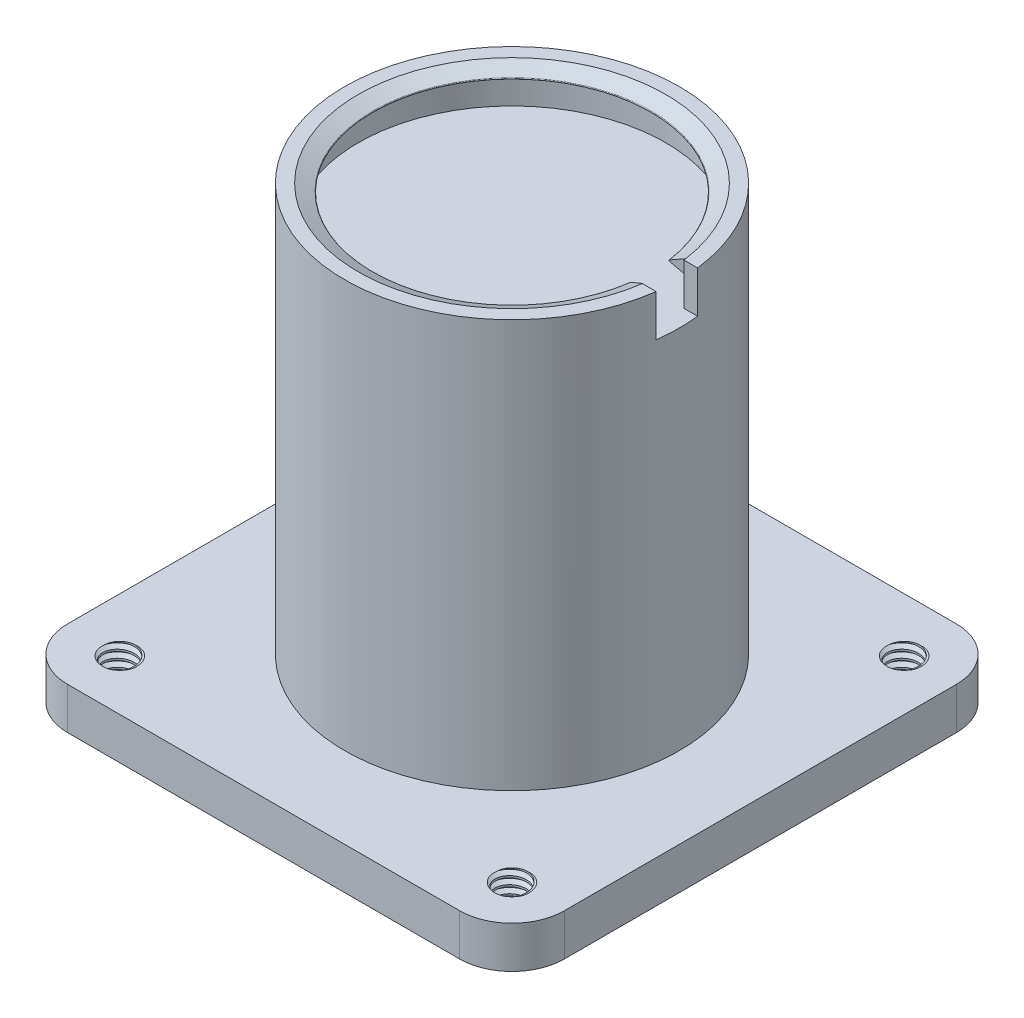
from build123d import *

# Parameters (mm, degrees)
BOSS_EXTRUDE2_DEPTH      = 8
SKETCH2_R                = 29.4
BOSS_EXTRUDE3_DEPTH      = 70
SKETCH3_R                = 32
SKETCH3_R_2              = 29.4
BOSS_EXTRUDE4_DEPTH      = 78
CUT_EXTRUDE2_START       = -8
CUT_EXTRUDE2_DEPTH       = 8
SKETCH5_R                = 3
CUT_EXTRUDE3_DEPTH       = 8
THREAD1_PITCH            = 1.5
THREAD3_PITCH            = 1.5
THREAD4_PITCH            = 1.5
THREAD5_PITCH            = 1.5
REVOLVE1_ANGLE           = 172
REVOLVE1_OTHER_WAY_ANGLE = 172


with BuildPart() as part:
    # Sketch1 → Boss-Extrude2 (new body)
    with BuildSketch(Plane(origin=(0, 0, 0), x_dir=(1, 0, 0), z_dir=(0, 1, 0))):
        with BuildLine():
            Line((-37.5, -47.5), (37.5, -47.5))
            ThreePointArc((37.5, -47.5), (44.571067812, -44.571067812), (47.5, -37.5))
            Line((47.5, -37.5), (47.5, 37.5))
            ThreePointArc((47.5, 37.5), (44.571067812, 44.571067812), (37.5, 47.5))
            Line((37.5, 47.5), (-37.5, 47.5))
            ThreePointArc((-37.5, 47.5), (-44.571067812, 44.571067812), (-47.5, 37.5))
            Line((-47.5, 37.5), (-47.5, -37.5))
            ThreePointArc((-47.5, -37.5), (-44.571067812, -44.571067812), (-37.5, -47.5))
        make_face()
    extrude(amount=BOSS_EXTRUDE2_DEPTH)

    # Sketch2 → Boss-Extrude3 (add)
    with BuildSketch(Plane(origin=(0, 8, 0), x_dir=(1, 0, 0), z_dir=(0, 1, 0))):
        with Locations(Location((0, 0, 0), (0, 0, 270))):
            Circle(SKETCH2_R)
    extrude(amount=BOSS_EXTRUDE3_DEPTH)

    # Sketch3 → Boss-Extrude4 (add)
    with BuildSketch(Plane(origin=(0, 8, 0), x_dir=(1, 0, 0), z_dir=(0, 1, 0))):
        with Locations(Location((0, 0, 0), (0, 0, 90))):
            Circle(SKETCH3_R)
        with Locations(Location((0, 0, 0), (0, 0, 270))):
            Circle(SKETCH3_R_2, mode=Mode.SUBTRACT)
    extrude(amount=BOSS_EXTRUDE4_DEPTH)

    # Sketch4 → Cut-Extrude2 (cut)
    with BuildSketch(Plane(origin=(0, 86, 0), x_dir=(1, 0, 0), z_dir=(0, 1, 0)).offset(CUT_EXTRUDE2_START)):
        with BuildLine():
            Line((29.165505241, 3.705847279), (31.784692793, 3.705847279))
            ThreePointArc((31.784692793, 3.705847279), (31.999134477, -0.235356547), (31.726743304, -4.172979673))
            Line((31.726743304, -4.172979673), (29.10234081, -4.172979673))
            ThreePointArc((29.10234081, -4.172979673), (29.399055247, -0.235691758), (29.165505241, 3.705847279))
        make_face()
    extrude(amount=CUT_EXTRUDE2_DEPTH, mode=Mode.SUBTRACT)

    # Sketch5 → Cut-Extrude3 (cut)
    with BuildSketch(Plane(origin=(0, 8, 0), x_dir=(1, 0, 0), z_dir=(0, 1, 0))):
        with Locations(Location((-37.5, -37.5, 0), (0, 0, 270))):
            Circle(SKETCH5_R)
        with Locations(Location((-37.5, 37.5, 0), (0, 0, 270))):
            Circle(SKETCH5_R)
        with Locations(Location((37.5, -37.5, 0), (0, 0, 270))):
            Circle(SKETCH5_R)
        with Locations(Location((37.5, 37.5, 0), (0, 0, 270))):
            Circle(SKETCH5_R)
    extrude(amount=-CUT_EXTRUDE3_DEPTH, mode=Mode.SUBTRACT)

    # Thread1: the profile of Thread Profile1 profile screwed along a right-hand helix of 6.666667 turns, 8 arcs to a turn; built about Z, then put on its axis
    thread1_z = Axis((0, 0, 0), (0, 0, 1))
    thread1_corners = [(2.9997, 0, -0.000173205), (3.811898813, 0, 0.468749998), (3.811898813, 0, 0.656249998), (2.9997, 0, 1.125173201)]
    with BuildLine(mode=Mode.PRIVATE) as thread1_profile:
        Line(thread1_corners[0], thread1_corners[1])
        Line(thread1_corners[1], thread1_corners[2])
        Line(thread1_corners[2], thread1_corners[3])
        Line(thread1_corners[3], thread1_corners[0])
    thread1_cap = Face(thread1_profile.wire())
    thread1_turn_angles = [0, 22.5, 45, 67.5, 90, 112.5, 135, 157.5, 180, 202.5, 225, 247.5, 270, 292.5, 315, 337.5, 360]
    thread1_turn_weights = [1, 0.9238795325112867, 1, 0.9238795325112867, 1, 0.9238795325112867, 1, 0.9238795325112867, 1, 0.9238795325112867, 1, 0.9238795325112867, 1, 0.9238795325112867, 1, 0.9238795325112867, 1]
    thread1_turn_rails = [Edge.make_bspline([Vector(p[0], p[1], 0).rotate(thread1_z, thread1_turn_angles[k]) / thread1_turn_weights[k] + Vector(0, 0, p[2] + THREAD1_PITCH * thread1_turn_angles[k] / 360) for k in range(17)], [0, 0, 0, 1, 1, 2, 2, 3, 3, 4, 4, 5, 5, 6, 6, 7, 7, 8, 8, 8], 2, thread1_turn_weights) for p in thread1_corners]
    thread1_turn_sides = [Face.make_surface_from_curves(thread1_turn_rails[p[0]], thread1_turn_rails[p[1]]) for p in [(0, 1), (1, 2), (2, 3), (3, 0)]]
    thread1_last_angles = [2160, 2182.5, 2205, 2227.5, 2250, 2272.5, 2295, 2317.5, 2340, 2362.5, 2385, 2392.5, 2400]
    thread1_last_weights = [1, 0.9238795325112867, 1, 0.9238795325112867, 1, 0.9238795325112867, 1, 0.9238795325112867, 1, 0.9238795325112867, 1, 0.9914448613738109, 1]
    thread1_last_rails = [Edge.make_bspline([Vector(p[0], p[1], 0).rotate(thread1_z, thread1_last_angles[k]) / thread1_last_weights[k] + Vector(0, 0, p[2] + THREAD1_PITCH * thread1_last_angles[k] / 360) for k in range(13)], [0, 0, 0, 1, 1, 2, 2, 3, 3, 4, 4, 5, 5, 6, 6, 6], 2, thread1_last_weights) for p in thread1_corners]
    thread1_last_sides = [Face.make_surface_from_curves(thread1_last_rails[p[0]], thread1_last_rails[p[1]]) for p in [(0, 1), (1, 2), (2, 3), (3, 0)]]
    thread1 = Plane(origin=(-37.5, 9.5, -37.5), x_dir=(-1, 0, 0), z_dir=(0, -1, 0)) * Solid(Shell([*[p.moved(Location((0, 0, THREAD1_PITCH * i))) for i in range(6) for p in thread1_turn_sides], *thread1_last_sides, thread1_cap, thread1_cap.rotate(thread1_z, 2400).moved(Location((0, 0, THREAD1_PITCH * 2400 / 360)))]))
    add(thread1, mode=Mode.SUBTRACT)

    # Thread3: the profile of Thread Profile3 profile screwed along a right-hand helix of 6.666667 turns, 8 arcs to a turn; built about Z, then put on its axis
    thread3_z = Axis((0, 0, 0), (0, 0, 1))
    thread3_corners = [(2.9997, 0, -0.000173205), (3.811898813, 0, 0.468749998), (3.811898813, 0, 0.656249998), (2.9997, 0, 1.125173201)]
    with BuildLine(mode=Mode.PRIVATE) as thread3_profile:
        Line(thread3_corners[0], thread3_corners[1])
        Line(thread3_corners[1], thread3_corners[2])
        Line(thread3_corners[2], thread3_corners[3])
        Line(thread3_corners[3], thread3_corners[0])
    thread3_cap = Face(thread3_profile.wire())
    thread3_turn_angles = [0, 22.5, 45, 67.5, 90, 112.5, 135, 157.5, 180, 202.5, 225, 247.5, 270, 292.5, 315, 337.5, 360]
    thread3_turn_weights = [1, 0.9238795325112867, 1, 0.9238795325112867, 1, 0.9238795325112867, 1, 0.9238795325112867, 1, 0.9238795325112867, 1, 0.9238795325112867, 1, 0.9238795325112867, 1, 0.9238795325112867, 1]
    thread3_turn_rails = [Edge.make_bspline([Vector(p[0], p[1], 0).rotate(thread3_z, thread3_turn_angles[k]) / thread3_turn_weights[k] + Vector(0, 0, p[2] + THREAD3_PITCH * thread3_turn_angles[k] / 360) for k in range(17)], [0, 0, 0, 1, 1, 2, 2, 3, 3, 4, 4, 5, 5, 6, 6, 7, 7, 8, 8, 8], 2, thread3_turn_weights) for p in thread3_corners]
    thread3_turn_sides = [Face.make_surface_from_curves(thread3_turn_rails[p[0]], thread3_turn_rails[p[1]]) for p in [(0, 1), (1, 2), (2, 3), (3, 0)]]
    thread3_last_angles = [2160, 2182.5, 2205, 2227.5, 2250, 2272.5, 2295, 2317.5, 2340, 2362.5, 2385, 2392.5, 2400]
    thread3_last_weights = [1, 0.9238795325112867, 1, 0.9238795325112867, 1, 0.9238795325112867, 1, 0.9238795325112867, 1, 0.9238795325112867, 1, 0.9914448613738109, 1]
    thread3_last_rails = [Edge.make_bspline([Vector(p[0], p[1], 0).rotate(thread3_z, thread3_last_angles[k]) / thread3_last_weights[k] + Vector(0, 0, p[2] + THREAD3_PITCH * thread3_last_angles[k] / 360) for k in range(13)], [0, 0, 0, 1, 1, 2, 2, 3, 3, 4, 4, 5, 5, 6, 6, 6], 2, thread3_last_weights) for p in thread3_corners]
    thread3_last_sides = [Face.make_surface_from_curves(thread3_last_rails[p[0]], thread3_last_rails[p[1]]) for p in [(0, 1), (1, 2), (2, 3), (3, 0)]]
    thread3 = Plane(origin=(37.5, 9.5, -37.5), x_dir=(-1, 0, 0), z_dir=(0, -1, 0)) * Solid(Shell([*[p.moved(Location((0, 0, THREAD3_PITCH * i))) for i in range(6) for p in thread3_turn_sides], *thread3_last_sides, thread3_cap, thread3_cap.rotate(thread3_z, 2400).moved(Location((0, 0, THREAD3_PITCH * 2400 / 360)))]))
    add(thread3, mode=Mode.SUBTRACT)

    # Thread4: the profile of Thread Profile4 profile screwed along a right-hand helix of 6.666667 turns, 8 arcs to a turn; built about Z, then put on its axis
    thread4_z = Axis((0, 0, 0), (0, 0, 1))
    thread4_corners = [(2.9997, 0, -0.000173205), (3.811898812, 0, 0.468749998), (3.811898812, 0, 0.656249998), (2.9997, 0, 1.125173201)]
    with BuildLine(mode=Mode.PRIVATE) as thread4_profile:
        Line(thread4_corners[0], thread4_corners[1])
        Line(thread4_corners[1], thread4_corners[2])
        Line(thread4_corners[2], thread4_corners[3])
        Line(thread4_corners[3], thread4_corners[0])
    thread4_cap = Face(thread4_profile.wire())
    thread4_turn_angles = [0, 22.5, 45, 67.5, 90, 112.5, 135, 157.5, 180, 202.5, 225, 247.5, 270, 292.5, 315, 337.5, 360]
    thread4_turn_weights = [1, 0.9238795325112867, 1, 0.9238795325112867, 1, 0.9238795325112867, 1, 0.9238795325112867, 1, 0.9238795325112867, 1, 0.9238795325112867, 1, 0.9238795325112867, 1, 0.9238795325112867, 1]
    thread4_turn_rails = [Edge.make_bspline([Vector(p[0], p[1], 0).rotate(thread4_z, thread4_turn_angles[k]) / thread4_turn_weights[k] + Vector(0, 0, p[2] + THREAD4_PITCH * thread4_turn_angles[k] / 360) for k in range(17)], [0, 0, 0, 1, 1, 2, 2, 3, 3, 4, 4, 5, 5, 6, 6, 7, 7, 8, 8, 8], 2, thread4_turn_weights) for p in thread4_corners]
    thread4_turn_sides = [Face.make_surface_from_curves(thread4_turn_rails[p[0]], thread4_turn_rails[p[1]]) for p in [(0, 1), (1, 2), (2, 3), (3, 0)]]
    thread4_last_angles = [2160, 2182.5, 2205, 2227.5, 2250, 2272.5, 2295, 2317.5, 2340, 2362.5, 2385, 2392.5, 2400]
    thread4_last_weights = [1, 0.9238795325112867, 1, 0.9238795325112867, 1, 0.9238795325112867, 1, 0.9238795325112867, 1, 0.9238795325112867, 1, 0.9914448613738109, 1]
    thread4_last_rails = [Edge.make_bspline([Vector(p[0], p[1], 0).rotate(thread4_z, thread4_last_angles[k]) / thread4_last_weights[k] + Vector(0, 0, p[2] + THREAD4_PITCH * thread4_last_angles[k] / 360) for k in range(13)], [0, 0, 0, 1, 1, 2, 2, 3, 3, 4, 4, 5, 5, 6, 6, 6], 2, thread4_last_weights) for p in thread4_corners]
    thread4_last_sides = [Face.make_surface_from_curves(thread4_last_rails[p[0]], thread4_last_rails[p[1]]) for p in [(0, 1), (1, 2), (2, 3), (3, 0)]]
    thread4 = Plane(origin=(37.5, 9.5, 37.5), x_dir=(-1, 0, 0), z_dir=(0, -1, 0)) * Solid(Shell([*[p.moved(Location((0, 0, THREAD4_PITCH * i))) for i in range(6) for p in thread4_turn_sides], *thread4_last_sides, thread4_cap, thread4_cap.rotate(thread4_z, 2400).moved(Location((0, 0, THREAD4_PITCH * 2400 / 360)))]))
    add(thread4, mode=Mode.SUBTRACT)

    # Thread5: the profile of Thread Profile5 profile screwed along a right-hand helix of 6.666667 turns, 8 arcs to a turn; built about Z, then put on its axis
    thread5_z = Axis((0, 0, 0), (0, 0, 1))
    thread5_corners = [(2.9997, 0, -0.000173205), (3.811898813, 0, 0.468749998), (3.811898813, 0, 0.656249998), (2.9997, 0, 1.125173201)]
    with BuildLine(mode=Mode.PRIVATE) as thread5_profile:
        Line(thread5_corners[0], thread5_corners[1])
        Line(thread5_corners[1], thread5_corners[2])
        Line(thread5_corners[2], thread5_corners[3])
        Line(thread5_corners[3], thread5_corners[0])
    thread5_cap = Face(thread5_profile.wire())
    thread5_turn_angles = [0, 22.5, 45, 67.5, 90, 112.5, 135, 157.5, 180, 202.5, 225, 247.5, 270, 292.5, 315, 337.5, 360]
    thread5_turn_weights = [1, 0.9238795325112867, 1, 0.9238795325112867, 1, 0.9238795325112867, 1, 0.9238795325112867, 1, 0.9238795325112867, 1, 0.9238795325112867, 1, 0.9238795325112867, 1, 0.9238795325112867, 1]
    thread5_turn_rails = [Edge.make_bspline([Vector(p[0], p[1], 0).rotate(thread5_z, thread5_turn_angles[k]) / thread5_turn_weights[k] + Vector(0, 0, p[2] + THREAD5_PITCH * thread5_turn_angles[k] / 360) for k in range(17)], [0, 0, 0, 1, 1, 2, 2, 3, 3, 4, 4, 5, 5, 6, 6, 7, 7, 8, 8, 8], 2, thread5_turn_weights) for p in thread5_corners]
    thread5_turn_sides = [Face.make_surface_from_curves(thread5_turn_rails[p[0]], thread5_turn_rails[p[1]]) for p in [(0, 1), (1, 2), (2, 3), (3, 0)]]
    thread5_last_angles = [2160, 2182.5, 2205, 2227.5, 2250, 2272.5, 2295, 2317.5, 2340, 2362.5, 2385, 2392.5, 2400]
    thread5_last_weights = [1, 0.9238795325112867, 1, 0.9238795325112867, 1, 0.9238795325112867, 1, 0.9238795325112867, 1, 0.9238795325112867, 1, 0.9914448613738109, 1]
    thread5_last_rails = [Edge.make_bspline([Vector(p[0], p[1], 0).rotate(thread5_z, thread5_last_angles[k]) / thread5_last_weights[k] + Vector(0, 0, p[2] + THREAD5_PITCH * thread5_last_angles[k] / 360) for k in range(13)], [0, 0, 0, 1, 1, 2, 2, 3, 3, 4, 4, 5, 5, 6, 6, 6], 2, thread5_last_weights) for p in thread5_corners]
    thread5_last_sides = [Face.make_surface_from_curves(thread5_last_rails[p[0]], thread5_last_rails[p[1]]) for p in [(0, 1), (1, 2), (2, 3), (3, 0)]]
    thread5 = Plane(origin=(-37.5, 9.5, 37.5), x_dir=(-1, 0, 0), z_dir=(0, -1, 0)) * Solid(Shell([*[p.moved(Location((0, 0, THREAD5_PITCH * i))) for i in range(6) for p in thread5_turn_sides], *thread5_last_sides, thread5_cap, thread5_cap.rotate(thread5_z, 2400).moved(Location((0, 0, THREAD5_PITCH * 2400 / 360)))]))
    add(thread5, mode=Mode.SUBTRACT)

    # Sketch6 → Revolve1 (revolve)
    with BuildSketch(Plane.XY):
        with BuildLine():
            Line((-29.4, 86), (-29.4, 83.312441505))
            Line((-29.4, 83.312441505), (-26.655145377, 84.39899998))
            ThreePointArc((-26.655145377, 84.39899998), (-26.574714305, 84.513286334), (-26.655145377, 84.627572689))
            Line((-26.655145377, 84.627572689), (-29.4, 86))
        make_face()
    revolve(axis=Axis((0, 0, 0), (0, 1, 0)), revolution_arc=REVOLVE1_ANGLE)

    # Sketch6 → Revolve1 other way (revolve)
    with BuildSketch(Plane.XY):
        with BuildLine():
            Line((-29.4, 86), (-29.4, 83.312441505))
            Line((-29.4, 83.312441505), (-26.655145377, 84.39899998))
            ThreePointArc((-26.655145377, 84.39899998), (-26.574714305, 84.513286334), (-26.655145377, 84.627572689))
            Line((-26.655145377, 84.627572689), (-29.4, 86))
        make_face()
    revolve(axis=Axis((0, 0, 0), (0, -1, 0)), revolution_arc=REVOLVE1_OTHER_WAY_ANGLE)


solid = part.part
